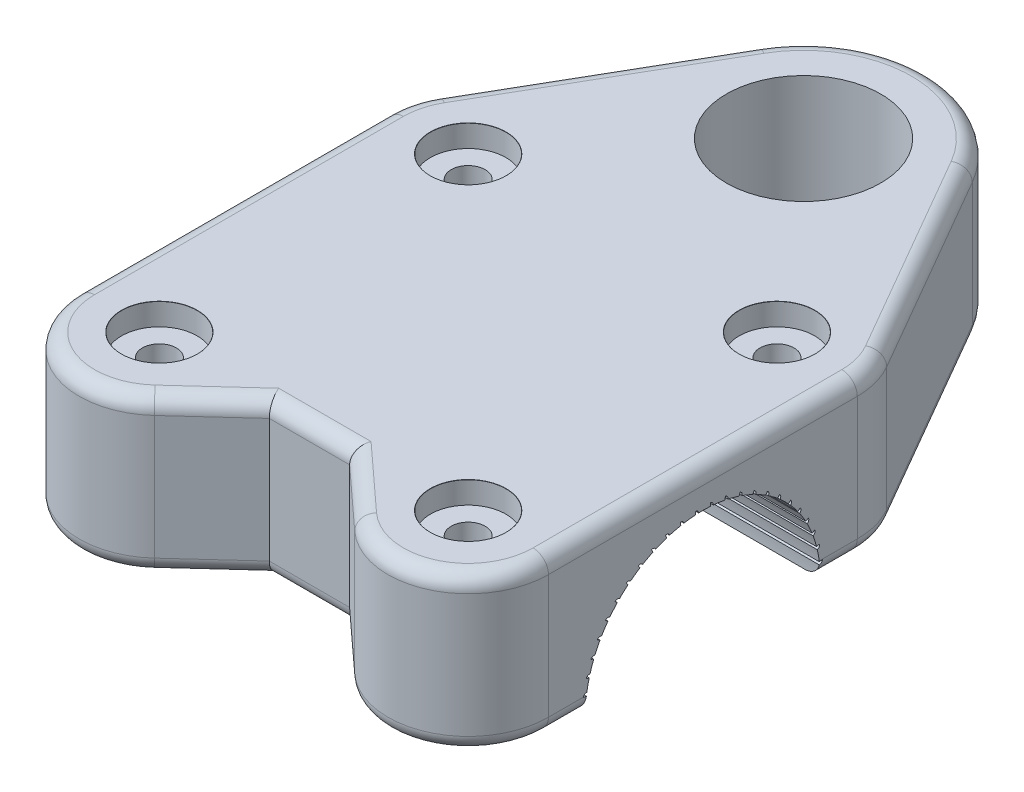
from build123d import *

# Parameters (mm, degrees)
BOSS_EXTRUDE1_DEPTH     = 25
LPATTERN2_COUNT         = 2
LPATTERN2_PITCH         = 50
LPATTERN2_COUNT_DIR2    = 2
LPATTERN2_PITCH_DIR2    = 50
SKETCH4_R               = 12.5
CUT_EXTRUDE1_DEPTH      = 110.859000542
CUT_EXTRUDE2_DEPTH      = 129.066389033
CUT_EXTRUDE2_DEPTH_BACK = 129.066389033
SKETCH7_R               = 0.5
CUT_EXTRUDE3_DEPTH      = 129.066389033
CIRPATTERN1_START       = -38
CIRPATTERN1_DEPTH       = 76
FILLET1_R               = 2.5


# Read off the part's stored shape, not the designer's step: CirPattern1
with BuildPart() as part:
    # Sketch1 → Boss-Extrude1 (new body)
    with BuildSketch(Plane(origin=(0, 0, 0), x_dir=(1, 0, 0), z_dir=(0, 1, 0))):
        with BuildLine():
            Line((6.5, 0), (-6.5, 0))
            Line((-6.5, 0), (-16.22720919, -8.894921288))
            ThreePointArc((-16.22720919, -8.894921288), (-30.241837439, -11.197620061), (-38, 0.698729811))
            Line((-38, 0.698729811), (-38, 50.698729811))
            ThreePointArc((-38, 50.698729811), (-37.557035742, 54.063377397), (-36.258330249, 57.198729811))
            Line((-36.258330249, 57.198729811), (-17.320508076, 90))
            ThreePointArc((-17.320508076, 90), (0, 100), (17.320508076, 90))
            Line((17.320508076, 90), (36.258330249, 57.198729811))
            ThreePointArc((36.258330249, 57.198729811), (37.557035742, 54.063377397), (38, 50.698729811))
            Line((38, 50.698729811), (38, 0.698729811))
            ThreePointArc((38, 0.698729811), (30.241837439, -11.197620061), (16.22720919, -8.894921288))
            Line((16.22720919, -8.894921288), (6.5, 0))
        make_face()
    extrude(amount=BOSS_EXTRUDE1_DEPTH)

    # Sketch2 → CBORE for M5 Hex Head Bolt1 (revolve, cut)
    with BuildSketch(Plane(origin=(-25, 25, -0.698729811), x_dir=(0, 0, 1), z_dir=(1, 0, 0))):
        Polygon((0, 0), (0, 25), (2.75, 25), (2.75, 3.58), (6.12, 3.58), (6.12, 0.025), (6.145, 0), align=None)
    cbore_for_m5_hex_head_bolt1 = revolve(axis=Axis((-25, 31.35, -0.698729811), (0, -1, 0)), mode=Mode.SUBTRACT)

    # LPattern2: CBORE for M5 Hex Head Bolt1 2 × 2
    with Locations(*[(i * LPATTERN2_PITCH, 0, -j * LPATTERN2_PITCH_DIR2) for i in range(LPATTERN2_COUNT) for j in range(LPATTERN2_COUNT_DIR2) if (i, j) != (0, 0)]):
        add(cbore_for_m5_hex_head_bolt1, mode=Mode.SUBTRACT)

    # Sketch4 → Cut-Extrude1 (cut, through all)
    with BuildSketch(Plane(origin=(0, 25, 0), x_dir=(1, 0, 0), z_dir=(0, 1, 0))):
        with Locations(Location((0, 80, 0), (0, 0, 270))):
            Circle(SKETCH4_R)
    extrude(amount=-CUT_EXTRUDE1_DEPTH, mode=Mode.SUBTRACT)

    # Sketch6 → Cut-Extrude2 (cut, two sides: drawn at the far end of the back side and taken through both)
    with BuildSketch(Plane(origin=(38, 0, 0), x_dir=(0, 0, -1), z_dir=(1, 0, 0)).offset(-CUT_EXTRUDE2_DEPTH_BACK)):
        with BuildLine():
            Line((44.698729811, -203.185165258), (44.698729811, 0))
            ThreePointArc((44.698729811, 0), (25.698729811, 19), (6.698729811, 0))
            Line((6.698729811, 0), (6.698729811, -203.185165258))
            Line((6.698729811, -203.185165258), (6.698729811, -609.555495773))
            Line((6.698729811, -609.555495773), (44.698729811, -609.555495773))
            Line((44.698729811, -609.555495773), (44.698729811, -203.185165258))
        make_face()
    extrude(amount=CUT_EXTRUDE2_DEPTH + CUT_EXTRUDE2_DEPTH_BACK, mode=Mode.SUBTRACT)

    # Sketch7 → Cut-Extrude3 (cut, through all)
    with BuildSketch(Plane(origin=(38, 0, 0), x_dir=(0, 0, -1), z_dir=(1, 0, 0))):
        with Locations((6.698729811, 0)):
            Circle(SKETCH7_R)
    extrude(amount=-CUT_EXTRUDE3_DEPTH, mode=Mode.SUBTRACT)

    # CirPattern1 outline → CirPattern1 (cut)
    with BuildSketch(Plane.YZ.offset(CIRPATTERN1_START)):
        with BuildLine():
            ThreePointArc((2.876521285, -6.917738748), (2.778416579, -6.544702842), (2.443998055, -6.352493135))
            Line((2.443998055, -6.352493135), (2.381331438, -6.848550486))
            ThreePointArc((2.381331438, -6.848550486), (2.629153964, -6.881515632), (2.876521285, -6.917738748))
        make_face()
        with BuildLine():
            Line((2.443998055, -45.044966486), (2.381331438, -44.548909136))
            ThreePointArc((2.381331438, -44.548909136), (2.133096613, -44.578610606), (1.884492469, -44.605043257))
            ThreePointArc((1.884492469, -44.605043257), (2.072285293, -44.941961906), (2.443998055, -45.044966486))
        make_face()
        with BuildLine():
            Line((4.8494528, -44.586101453), (4.725107856, -44.101809872))
            ThreePointArc((4.725107856, -44.101809872), (4.482553018, -44.162389211), (4.239222082, -44.219771794))
            ThreePointArc((4.239222082, -44.219771794), (4.467761207, -44.530497057), (4.8494528, -44.586101453))
        make_face()
        with BuildLine():
            Line((7.178428777, -43.829371286), (6.994366501, -43.364483043))
            ThreePointArc((6.994366501, -43.364483043), (6.761316885, -43.454984877), (6.527096631, -43.542412434))
            ThreePointArc((6.527096631, -43.542412434), (6.792777858, -43.822043988), (7.178428777, -43.829371286))
        make_face()
        with BuildLine():
            Line((9.394196645, -42.786710072), (9.153319808, -42.348556732))
            ThreePointArc((9.153319808, -42.348556732), (8.933450745, -42.467553794), (8.712034966, -42.583647541))
            ThreePointArc((8.712034966, -42.583647541), (9.010668345, -42.827775429), (9.394196645, -42.786710072))
        make_face()
        with BuildLine():
            Line((11.46181242, -41.474561201), (11.167919794, -41.070052704))
            ThreePointArc((11.167919794, -41.070052704), (10.964698751, -41.215668339), (10.759579306, -41.358597408))
            ThreePointArc((10.759579306, -41.358597408), (11.086455209, -41.563371588), (11.46181242, -41.474561201))
        make_face()
        with BuildLine():
            Line((13.348668566, -39.913618045), (13.006395013, -39.549133732))
            ThreePointArc((13.006395013, -39.549133732), (12.823026908, -39.719071495), (12.637438653, -39.886581808))
            ThreePointArc((12.637438653, -39.886581808), (12.987402052, -40.048772869), (13.348668566, -39.913618045))
        make_face()
        with BuildLine():
            Line((15.025008234, -38.128497611), (14.639751613, -37.809785616))
            ThreePointArc((14.639751613, -37.809785616), (14.479128269, -38.001365487), (14.315998042, -38.190815307))
            ThreePointArc((14.315998042, -38.190815307), (14.683529805, -38.307865399), (15.025008234, -38.128497611))
        make_face()
        with BuildLine():
            Line((16.464394547, -36.147352313), (16.042230585, -35.879438915))
            ThreePointArc((16.042230585, -35.879438915), (15.906885129, -36.089639564), (15.768785591, -36.298041156))
            ThreePointArc((15.768785591, -36.298041156), (16.148089523, -36.368104328), (16.464394547, -36.147352313))
        make_face()
        with BuildLine():
            Line((17.644127523, -34.001425996), (17.191713997, -33.788536351))
            ThreePointArc((17.191713997, -33.788536351), (17.083780907, -34.014042789), (16.972889971, -34.238109532))
            ThreePointArc((16.972889971, -34.238109532), (17.357984222, -34.260080847), (17.644127523, -34.001425996))
        make_face()
        with BuildLine():
            Line((18.545602068, -31.724561201), (18.07007381, -31.570052704))
            ThreePointArc((18.07007381, -31.570052704), (17.991255256, -31.80730856), (17.909321737, -32.04350679))
            ThreePointArc((17.909321737, -32.04350679), (18.294133141, -32.017039746), (18.545602068, -31.724561201))
        make_face()
        with BuildLine():
            Line((19.154601389, -29.352665445), (18.663457764, -29.258974788))
            ThreePointArc((18.663457764, -29.258974788), (18.614996761, -29.504238394), (18.563312801, -29.748843124))
            ThreePointArc((18.563312801, -29.748843124), (18.941772652, -29.674355124), (19.154601389, -29.352665445))
        make_face()
        with BuildLine():
            Line((19.461521204, -26.923144942), (18.96250784, -26.891749682))
            ThreePointArc((18.96250784, -26.891749682), (18.945168648, -27.141153086), (18.924549333, -27.390306752))
            ThreePointArc((18.924549333, -27.390306752), (19.290689093, -27.268972515), (19.461521204, -26.923144942))
        make_face()
        with BuildLine():
            Line((19.461521204, -24.47431468), (18.96250784, -24.50570994))
            ThreePointArc((18.96250784, -24.50570994), (18.976563908, -24.7553199), (18.987334417, -25.0050932))
            ThreePointArc((18.987334417, -25.0050932), (19.335379843, -24.83882624), (19.461521204, -24.47431468))
        make_face()
        with BuildLine():
            Line((19.154601389, -22.044794176), (18.663457764, -22.138484834))
            ThreePointArc((18.663457764, -22.138484834), (18.708687419, -22.384364853), (18.750677894, -22.630818713))
            ThreePointArc((18.750677894, -22.630818713), (19.075140102, -22.422241159), (19.154601389, -22.044794176))
        make_face()
        with BuildLine():
            Line((18.545602068, -19.67289842), (18.07007381, -19.827406918))
            ThreePointArc((18.07007381, -19.827406918), (18.145763753, -20.06567932), (18.21831198, -20.304927016))
            ThreePointArc((18.21831198, -20.304927016), (18.514074008, -20.057328261), (18.545602068, -19.67289842))
        make_face()
        with BuildLine():
            Line((17.644127523, -17.396033625), (17.191713997, -17.608923271))
            ThreePointArc((17.191713997, -17.608923271), (17.296670553, -17.835830359), (17.398632403, -18.064098812))
            ThreePointArc((17.398632403, -18.064098812), (17.661029906, -17.781383635), (17.644127523, -17.396033625))
        make_face()
        with BuildLine():
            Line((16.464394547, -15.250107309), (16.042230585, -15.518020706))
            ThreePointArc((16.042230585, -15.518020706), (16.174798526, -15.72998402), (16.304566, -15.943673299))
            ThreePointArc((16.304566, -15.943673299), (16.529460813, -15.630300288), (16.464394547, -15.250107309))
        make_face()
        with BuildLine():
            Line((15.025008234, -13.268962011), (14.639751613, -13.587674006))
            ThreePointArc((14.639751613, -13.587674006), (14.797840264, -13.781350757), (14.953366851, -13.977090855))
            ThreePointArc((14.953366851, -13.977090855), (15.137212248, -13.63800209), (15.025008234, -13.268962011))
        make_face()
        with BuildLine():
            Line((13.348668566, -11.483841576), (13.006395013, -11.84832589))
            ThreePointArc((13.006395013, -11.84832589), (13.187511221, -12.02066168), (13.366344174, -12.195365659))
            ThreePointArc((13.366344174, -12.195365659), (13.506240804, -11.835908772), (13.348668566, -11.483841576))
        make_face()
        with BuildLine():
            Line((11.46181242, -9.92289842), (11.167919794, -10.327406918))
            ThreePointArc((11.167919794, -10.327406918), (11.369207249, -10.475683909), (11.568526265, -10.626596582))
            ThreePointArc((11.568526265, -10.626596582), (11.662267874, -10.252440423), (11.46181242, -9.92289842))
        make_face()
        with BuildLine():
            Line((9.394196645, -8.61074955), (9.153319808, -9.04890289))
            ThreePointArc((9.153319808, -9.04890289), (9.371604086, -9.170782665), (9.588265785, -9.29552405))
            ThreePointArc((9.588265785, -9.29552405), (9.634374013, -8.912569285), (9.394196645, -8.61074955))
        make_face()
        with BuildLine():
            Line((7.178428777, -7.568088336), (6.994366501, -8.032976579))
            ThreePointArc((6.994366501, -8.032976579), (7.226205128, -8.126537021), (7.456792627, -8.223139872))
            ThreePointArc((7.456792627, -8.223139872), (7.454540318, -7.837425926), (7.178428777, -7.568088336))
        make_face()
        with BuildLine():
            Line((4.8494528, -6.811358169), (4.725107856, -7.295649749))
            ThreePointArc((4.725107856, -7.295649749), (4.966844599, -7.359415354), (5.207721394, -7.426356186))
            ThreePointArc((5.207721394, -7.426356186), (5.15714407, -7.043965999), (4.8494528, -6.811358169))
        make_face()
    extrude(amount=CIRPATTERN1_DEPTH, mode=Mode.SUBTRACT)

    # Fillet1
    fillet1_edges = [part.edges().sort_by_distance(p)[0] for p in [
        (38, 0, -47.698729811),
        (-38, 0, -47.698729811),
        (-37.557035742, 0, -54.063377397),
        (-26.789419162, 0, -73.599364905),
        (0, 0, -100),
        (-38, 0, -3.448729811),
        (-30.241837439, 0, 11.197620061),
        (11.363604595, 0, 4.447460644),
        (38, 0, -3.448729811),
        (11.363604595, 25, 4.447460644),
        (30.241837439, 25, 11.197620061),
        (38, 25, -25.698729811),
        (37.557035742, 25, -54.063377397),
        (26.789419162, 25, -73.599364905),
        (0, 25, -100),
        (-26.789419162, 25, -73.599364905),
        (-37.557035742, 25, -54.063377397),
        (-38, 25, -25.698729811),
        (37.557035742, 0, -54.063377397),
        (26.789419162, 0, -73.599364905),
        (-11.363604595, 0, 4.447460644),
        (30.241837439, 0, 11.197620061),
        (0, 0, 0),
        (-30.241837439, 25, 11.197620061),
        (-11.363604595, 25, 4.447460644),
        (0, 25, 0),
    ]]
    fillet(fillet1_edges, radius=FILLET1_R)


solid = part.part
